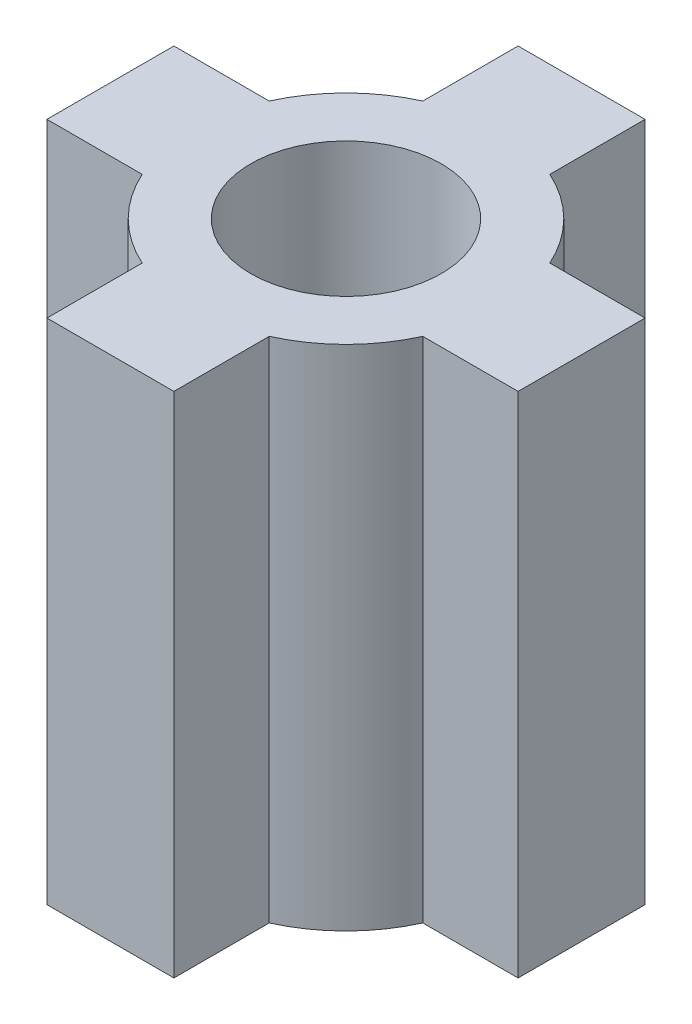
from build123d import *

# Parameters (mm, degrees)
SKETCH1_R           = 2.425
SKETCH1_R_2         = 1.5
BOSS_EXTRUDE1_DEPTH = 8
BOSS_EXTRUDE2_START = -8
BOSS_EXTRUDE2_DEPTH = 8
CIRPATTERN1_COUNT   = 4
BOSS_EXTRUDE3_DEPTH = 1.25
FILLET1_R           = 0.1


with BuildPart() as part:
    # Sketch1 → Boss-Extrude1 (new body)
    with BuildSketch(Plane(origin=(0, 0, 0), x_dir=(1, 0, 0), z_dir=(0, 1, 0))):
        with Locations(Location((0, 0, 0), (0, 0, 270))):
            Circle(SKETCH1_R)
        with Locations(Location((0, 0, 0), (0, 0, 270))):
            Circle(SKETCH1_R_2, mode=Mode.SUBTRACT)
    extrude(amount=BOSS_EXTRUDE1_DEPTH)

    # Sketch2 → Boss-Extrude2 (add)
    with BuildSketch(Plane(origin=(0, 8, 0), x_dir=(1, 0, 0), z_dir=(0, 1, 0)).offset(BOSS_EXTRUDE2_START)):
        with BuildLine():
            Line((-3.71, -1), (-3.71, 1))
            Line((-3.71, 1), (-2.209213661, 1))
            ThreePointArc((-2.209213661, 1), (-2.425, 0), (-2.209213661, -1))
            Line((-2.209213661, -1), (-3.71, -1))
        make_face()
    boss_extrude2 = extrude(amount=BOSS_EXTRUDE2_DEPTH)

    # CirPattern1: Boss-Extrude2 ×4 about axis
    cirpattern1_axis = Axis((0, 0, 0), (0, 1, 0))
    for i in range(1, CIRPATTERN1_COUNT):
        add(boss_extrude2.rotate(cirpattern1_axis, i * 360 / CIRPATTERN1_COUNT))

    # Sketch3 → Boss-Extrude3 (add)
    with BuildSketch(Plane.XZ):
        with BuildLine():
            Line((-0.538516481, -1.4), (0.538516481, -1.4))
            ThreePointArc((0.538516481, -1.4), (0, -1.5), (-0.538516481, -1.4))
        make_face()
    extrude(amount=-BOSS_EXTRUDE3_DEPTH)

    # Fillet1
    fillet1_edges = [part.edges().sort_by_distance(p)[0] for p in [
        (0, 1.25, -1.5),
    ]]
    fillet(fillet1_edges, radius=FILLET1_R - 0.0001)  # a hair under: the kernel refuses the full size


solid = part.part
